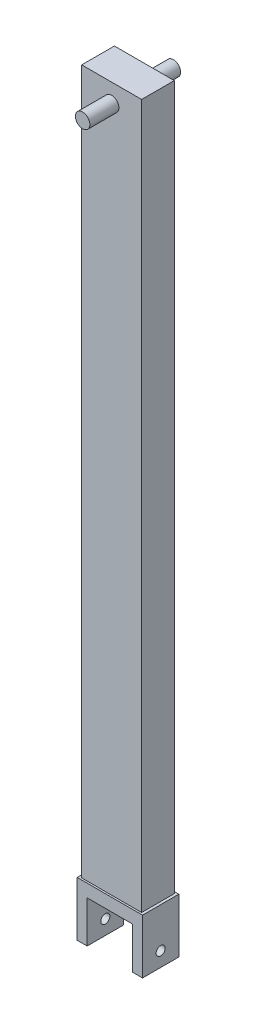
from build123d import *

# Parameters (mm, degrees)
SKETCH1_W           = 33
SKETCH1_H           = 18
BOSS_EXTRUDE1_DEPTH = 388
SKETCH3_R           = 4
BOSS_EXTRUDE2_DEPTH = 25
SKETCH4_W           = 36
SKETCH4_H           = 20
BOSS_EXTRUDE3_DEPTH = 30
SKETCH5_W           = 25
SKETCH5_H           = 45.982478268
CUT_EXTRUDE1_DEPTH  = 390.991025538
SKETCH6_R           = 2.5
CUT_EXTRUDE2_DEPTH  = 391.467668316


with BuildPart() as part:
    # Sketch1 → Boss-Extrude1 (new body)
    with BuildSketch(Plane(origin=(0, 0, 0), x_dir=(1, 0, 0), z_dir=(0, 1, 0))):
        Rectangle(SKETCH1_W, SKETCH1_H)
    extrude(amount=BOSS_EXTRUDE1_DEPTH)

    # Sketch3 → Boss-Extrude2 (add, symmetric)
    with BuildSketch(Plane.XY):
        with Locations((0, 377.75)):
            Circle(SKETCH3_R)
    extrude(amount=BOSS_EXTRUDE2_DEPTH, both=True)

    # Sketch4 → Boss-Extrude3 (add)
    with BuildSketch(Plane.XZ):
        Rectangle(SKETCH4_W, SKETCH4_H)
    extrude(amount=BOSS_EXTRUDE3_DEPTH)

    # Sketch5 → Cut-Extrude1 (cut, through all)
    with BuildSketch(Plane.XY.offset(10)):
        with Locations((0, -30)):
            Rectangle(SKETCH5_W, SKETCH5_H)
    extrude(amount=-CUT_EXTRUDE1_DEPTH, mode=Mode.SUBTRACT)

    # Sketch6 → Cut-Extrude2 (cut, through all)
    with BuildSketch(Plane(origin=(18, 0, 0), x_dir=(0, 0, -1), z_dir=(1, 0, 0))):
        with Locations((0, -22)):
            Circle(SKETCH6_R)
    extrude(amount=-CUT_EXTRUDE2_DEPTH, mode=Mode.SUBTRACT)


solid = part.part
